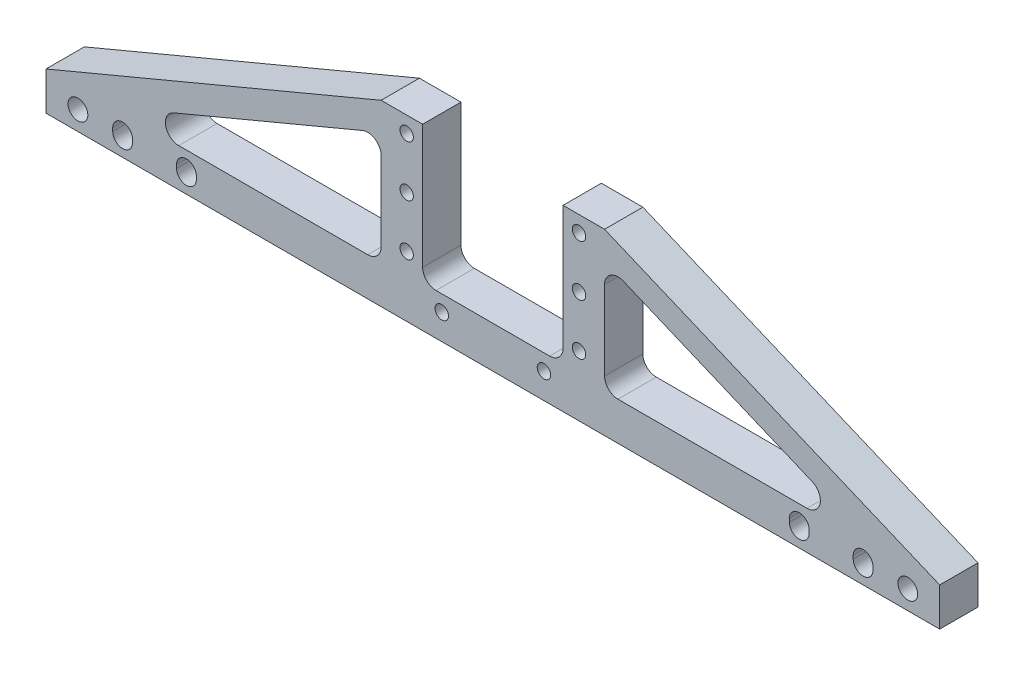
from build123d import *

# Parameters (mm, degrees)
SKETCH_1_R          = 1.05
SKETCH_1_R_2        = 1.55
EXTRUDE_1_DEPTH     = 6
SKETCH_2_R          = 1.55
CUT_EXTRUDE_1_DEPTH = 3
CUT_EXTRUDE_2_DEPTH = 75.242844773


with BuildPart() as part:
    # ｽｹｯﾁ1 → ﾎﾞｽ - 押し出し1 (new body)
    with BuildSketch(Plane.XY):
        with BuildLine():
            Line((-11, 4.6), (-11, 24))
            Line((-11, 24), (-17.5, 24))
            Line((-17.5, 24), (-70, 2))
            Line((-70, 2), (-70, -4))
            Line((-70, -4), (-17.5, -4))
            Line((-17.5, -4), (17.5, -4))
            Line((17.5, -4), (70, -4))
            Line((70, -4), (70, 2))
            Line((70, 2), (17.5, 24))
            Line((17.5, 24), (11, 24))
            Line((11, 24), (11, 4.6))
            ThreePointArc((11, 4.6), (10.38492424, 3.11507576), (8.9, 2.5))
            Line((8.9, 2.5), (-8.9, 2.5))
            ThreePointArc((-8.9, 2.5), (-10.38492424, 3.11507576), (-11, 4.6))
        make_face()
        with Locations((-13.5, 5.5)):
            Circle(SKETCH_1_R, mode=Mode.SUBTRACT)
        with Locations((-8, 0)):
            Circle(SKETCH_1_R, mode=Mode.SUBTRACT)
        with Locations((8, 0)):
            Circle(SKETCH_1_R, mode=Mode.SUBTRACT)
        with Locations((-13.5, 13.5)):
            Circle(SKETCH_1_R, mode=Mode.SUBTRACT)
        with Locations((-13.5, 21.5)):
            Circle(SKETCH_1_R, mode=Mode.SUBTRACT)
        with Locations((13.5, 21.5)):
            Circle(SKETCH_1_R, mode=Mode.SUBTRACT)
        with Locations((13.5, 13.5)):
            Circle(SKETCH_1_R, mode=Mode.SUBTRACT)
        with Locations((13.5, 5.5)):
            Circle(SKETCH_1_R, mode=Mode.SUBTRACT)
        with Locations((-65, -1)):
            Circle(SKETCH_1_R_2, mode=Mode.SUBTRACT)
        with Locations((65, -1)):
            Circle(SKETCH_1_R_2, mode=Mode.SUBTRACT)
        with BuildLine():
            Line((-17.5, 4.1), (-17.5, 16.506066998))
            ThreePointArc((-17.5, 16.506066998), (-18.436901101, 18.254552329), (-20.411619954, 18.442887344))
            Line((-20.411619954, 18.442887344), (-50.017007109, 6.036820345))
            ThreePointArc((-50.017007109, 6.036820345), (-51.264188108, 3.686069284), (-49.205387155, 2))
            Line((-49.205387155, 2), (-19.6, 2))
            ThreePointArc((-19.6, 2), (-18.11507576, 2.61507576), (-17.5, 4.1))
        make_face(mode=Mode.SUBTRACT)
        with BuildLine():
            Line((20.411619954, 18.442887344), (50.017007109, 6.036820345))
            ThreePointArc((50.017007109, 6.036820345), (51.264188108, 3.686069284), (49.205387155, 2))
            Line((49.205387155, 2), (19.6, 2))
            ThreePointArc((19.6, 2), (18.11507576, 2.61507576), (17.5, 4.1))
            Line((17.5, 4.1), (17.5, 16.506066998))
            ThreePointArc((17.5, 16.506066998), (18.436901101, 18.254552329), (20.411619954, 18.442887344))
        make_face(mode=Mode.SUBTRACT)
    extrude(amount=EXTRUDE_1_DEPTH)

    # ｽｹｯﾁ2 → ｶｯﾄ - 押し出し1 (cut)
    with BuildSketch(Plane.XY.offset(6)):
        with Locations((-48, -1)):
            Circle(SKETCH_2_R)
        with Locations((48, -1)):
            Circle(SKETCH_2_R)
        with Locations((-58, -1)):
            Circle(SKETCH_2_R)
        with Locations((58, -1)):
            Circle(SKETCH_2_R)
    extrude(amount=-CUT_EXTRUDE_1_DEPTH, mode=Mode.SUBTRACT)

    # ｽｹｯﾁ3 → ｶｯﾄ - 押し出し2 (cut, through all)
    with BuildSketch(Plane(origin=(0, 0, 0), x_dir=(-1, 0, 0), z_dir=(0, 0, -1))):
        with BuildLine():
            Line((-56.45, -0.75), (-56.45, -1.25))
            ThreePointArc((-56.45, -1.25), (-58, -2.8), (-59.55, -1.25))
            Line((-59.55, -1.25), (-59.55, -0.75))
            ThreePointArc((-59.55, -0.75), (-58, 0.8), (-56.45, -0.75))
        make_face()
        with BuildLine():
            Line((-46.45, -0.75), (-46.45, -1.25))
            ThreePointArc((-46.45, -1.25), (-48, -2.8), (-49.55, -1.25))
            Line((-49.55, -1.25), (-49.55, -0.75))
            ThreePointArc((-49.55, -0.75), (-48, 0.8), (-46.45, -0.75))
        make_face()
        with BuildLine():
            Line((56.45, -0.75), (56.45, -1.25))
            ThreePointArc((56.45, -1.25), (58, -2.8), (59.55, -1.25))
            Line((59.55, -1.25), (59.55, -0.75))
            ThreePointArc((59.55, -0.75), (58, 0.8), (56.45, -0.75))
        make_face()
        with BuildLine():
            Line((46.45, -0.75), (46.45, -1.25))
            ThreePointArc((46.45, -1.25), (48, -2.8), (49.55, -1.25))
            Line((49.55, -1.25), (49.55, -0.75))
            ThreePointArc((49.55, -0.75), (48, 0.8), (46.45, -0.75))
        make_face()
    extrude(amount=-CUT_EXTRUDE_2_DEPTH, mode=Mode.SUBTRACT)


solid = part.part
